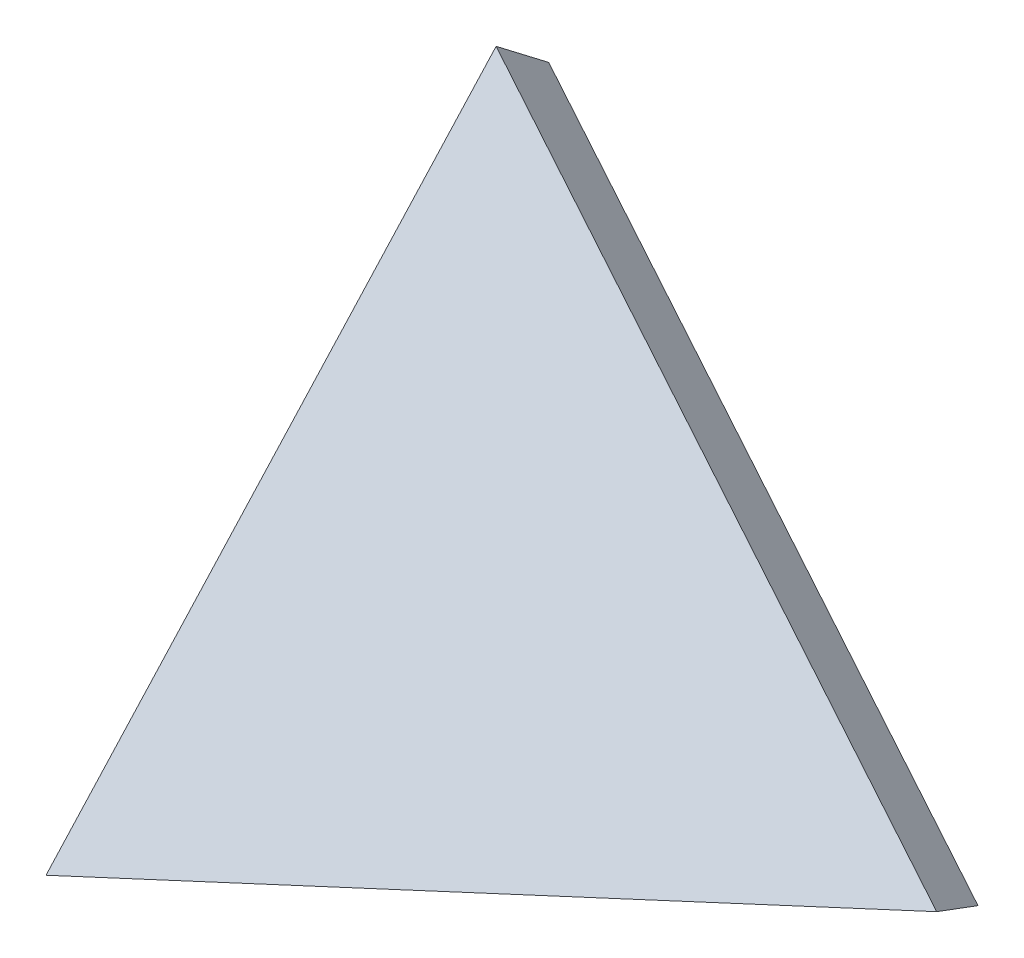
from build123d import *

# Parameters (mm, degrees)
BOSS_EXTRUDE1_DEPTH = 70
CHAMFER1_SIZE2      = 5.656659752
CHAMFER1_SIZE       = 70
CHAMFER2_SIZE2      = 70
CHAMFER2_SIZE       = 6.943744914
CHAMFER3_SIZE2      = 6.666257335
CHAMFER3_SIZE       = 70


with BuildPart() as part:
    # Sketch1 → Boss-Extrude1 (new body)
    with BuildSketch(Plane(origin=(-9.889310543, -592.27380366, -1254.98072345), x_dir=(0.9998495453727724, -0.017332267315879432, 0.0006921904012523395), z_dir=(-0.007446202576901621, -0.46490731349894177, -0.8853280431130489))):
        Polygon((-1515.522491278, 1908.617278557), (-785.459493052, 2356.346592467), (-1648.382414563, 2725.598184499), align=None)
    extrude(amount=BOSS_EXTRUDE1_DEPTH)

    # Chamfer1
    chamfer1_edges = [part.edges().sort_by_distance(p)[0] for p in [
        (-1266.956669693, -2852.967870133, -136.329178409),
    ]]
    chamfer1_side = [part.faces().sort_by_distance(p)[0] for p in [
        (-1266.95582728, -2852.915273683, -136.229018419),
    ]]
    chamfer(chamfer1_edges, length=CHAMFER1_SIZE - 0.0001, length2=CHAMFER1_SIZE2 - 0.0001, reference=chamfer1_side[0])  # a hair under: the kernel refuses the full size

    # Chamfer2
    chamfer2_edges = [part.edges().sort_by_distance(p)[0] for p in [
        (-1627.836641831, -2645.560867546, -242.208403318),
    ]]
    chamfer2_side = [part.faces().sort_by_distance(p)[0] for p in [
        (-1627.699937507, -2645.582975488, -242.197943675),
    ]]
    chamfer(chamfer2_edges, length=CHAMFER2_SIZE - 0.0001, length2=CHAMFER2_SIZE2 - 0.0001, reference=chamfer2_side[0])  # a hair under: the kernel refuses the full size

    # Chamfer3
    chamfer3_edges = [part.edges().sort_by_distance(p)[0] for p in [
        (-1193.89566166, -2492.66428344, -326.14785738),
    ]]
    chamfer3_side = [part.faces().sort_by_distance(p)[0] for p in [
        (-1193.894668894, -2492.602299605, -326.029820889),
    ]]
    chamfer(chamfer3_edges, length=CHAMFER3_SIZE - 0.0001, length2=CHAMFER3_SIZE2 - 0.0001, reference=chamfer3_side[0])  # a hair under: the kernel refuses the full size


solid = part.part
